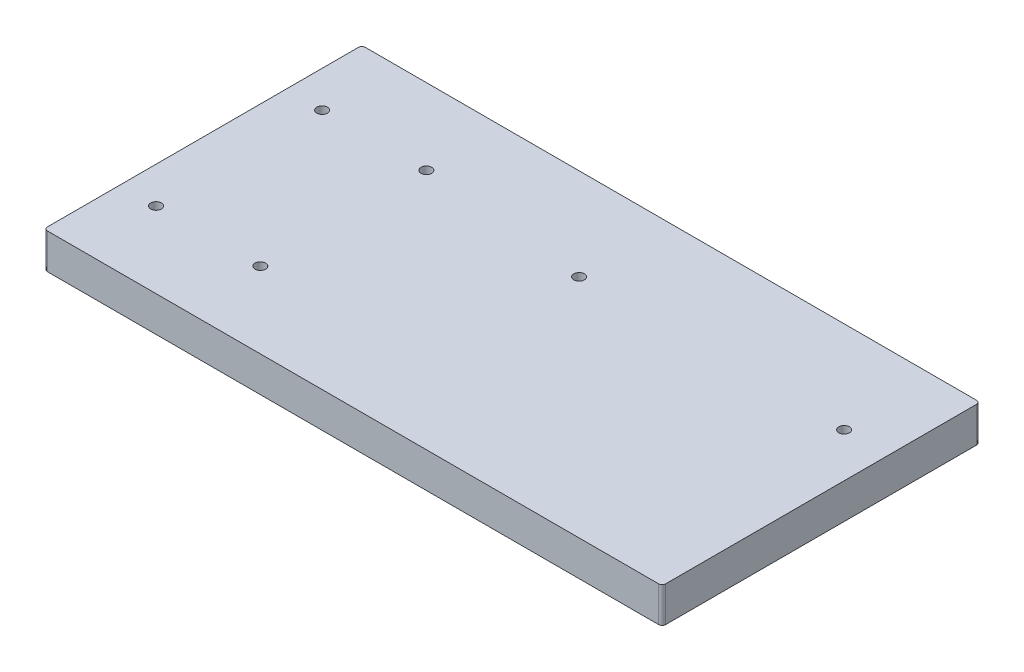
from build123d import *

# Parameters (mm, degrees)
SKETCH1_W           = 175
SKETCH1_H           = 90
BOSS_EXTRUDE1_DEPTH = 10
SKETCH2_R           = 1.5
CUT_EXTRUDE1_DEPTH  = 99.900202224
FILLET1_R           = 1
SKETCH2_9_R         = 1.5
CUT_EXTRUDE2_DEPTH  = 99.900202224


with BuildPart() as part:
    # Sketch1 → Boss-Extrude1 (new body)
    with BuildSketch(Plane(origin=(0, 0, 0), x_dir=(1, 0, 0), z_dir=(0, 1, 0))):
        Rectangle(SKETCH1_W, SKETCH1_H)
    extrude(amount=BOSS_EXTRUDE1_DEPTH)

    # Sketch2 → Cut-Extrude1 (cut, through all)
    with BuildSketch(Plane(origin=(0, 10, 0), x_dir=(1, 0, 0), z_dir=(0, 1, 0))):
        with Locations((-77.25, -23.5)):
            Circle(SKETCH2_R)
        with Locations((-47.75, -23.5)):
            Circle(SKETCH2_R)
    cut_extrude1 = extrude(amount=-CUT_EXTRUDE1_DEPTH, mode=Mode.SUBTRACT)

    # Mirror1: Cut-Extrude1 across plane
    add(cut_extrude1.mirror(Plane.XY), mode=Mode.SUBTRACT)

    # Fillet1
    fillet1_edges = [part.edges().sort_by_distance(p)[0] for p in [
        (-87.5, 5, -45),
        (87.5, 5, -45),
        (87.5, 5, 45),
        (-87.5, 5, 45),
    ]]
    fillet(fillet1_edges, radius=FILLET1_R)

    # Sketch2<9> → Cut-Extrude2 (cut, through all)
    with BuildSketch(Plane(origin=(0, 10, 0), x_dir=(1, 0, 0), z_dir=(0, 1, 0))):
        with Locations((0, 19)):
            Circle(SKETCH2_9_R)
        with Locations((75, 19)):
            Circle(SKETCH2_9_R)
    extrude(amount=-CUT_EXTRUDE2_DEPTH, mode=Mode.SUBTRACT)


solid = part.part
